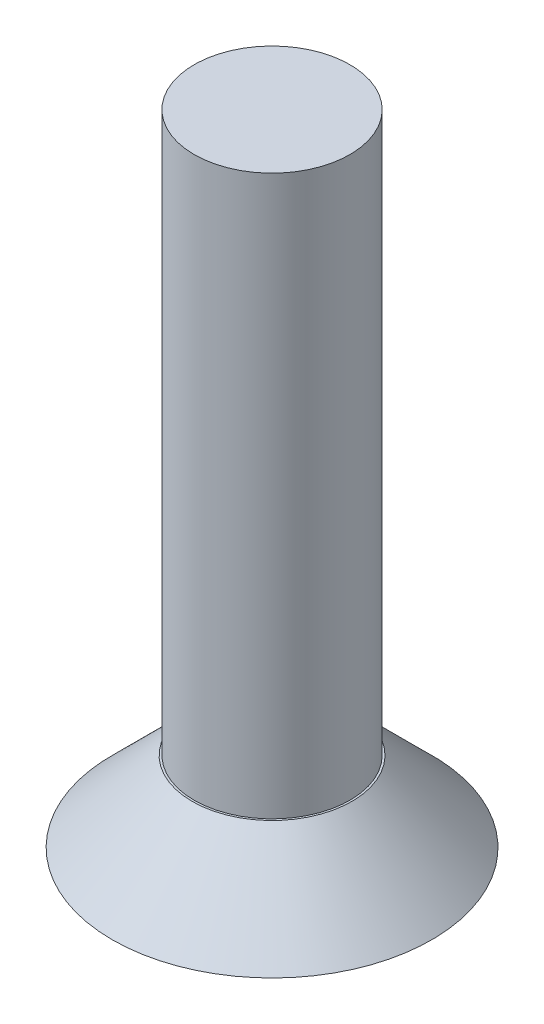
from build123d import *

# Parameters (mm, degrees)
SKETCH1_R           = 4
BOSS_EXTRUDE1_DEPTH = 2
SKETCH2_R           = 1.95
BOSS_EXTRUDE2_DEPTH = 14
CHAMFER1_SIZE       = 2
CUT_EXTRUDE1_DEPTH  = 1.5


with BuildPart() as part:
    # Sketch1 → Boss-Extrude1 (new body)
    with BuildSketch(Plane(origin=(0, 0, 0), x_dir=(1, 0, 0), z_dir=(0, 1, 0))):
        with Locations(Location((0, 0, 0), (0, 0, 270))):
            Circle(SKETCH1_R)
    extrude(amount=BOSS_EXTRUDE1_DEPTH)

    # Sketch2 → Boss-Extrude2 (add)
    with BuildSketch(Plane(origin=(0, 2, 0), x_dir=(1, 0, 0), z_dir=(0, 1, 0))):
        with Locations(Location((0, 0, 0), (0, 0, 270))):
            Circle(SKETCH2_R)
    extrude(amount=BOSS_EXTRUDE2_DEPTH)

    # Chamfer1
    chamfer1_edges = [part.edges().sort_by_distance(p)[0] for p in [
        (0, 2, -4),
    ]]
    chamfer(chamfer1_edges, length=CHAMFER1_SIZE - 0.0001)  # a hair under: the kernel refuses the full size

    # Sketch3 → Cut-Extrude1 (cut)
    with BuildSketch(Plane.XZ):
        Polygon((0, -1.662470902), (1.439742034, -0.831235451), (1.439742034, 0.831235451), (0, 1.662470902), (-1.439742034, 0.831235451), (-1.439742034, -0.831235451), align=None)
    extrude(amount=-CUT_EXTRUDE1_DEPTH, mode=Mode.SUBTRACT)


solid = part.part
